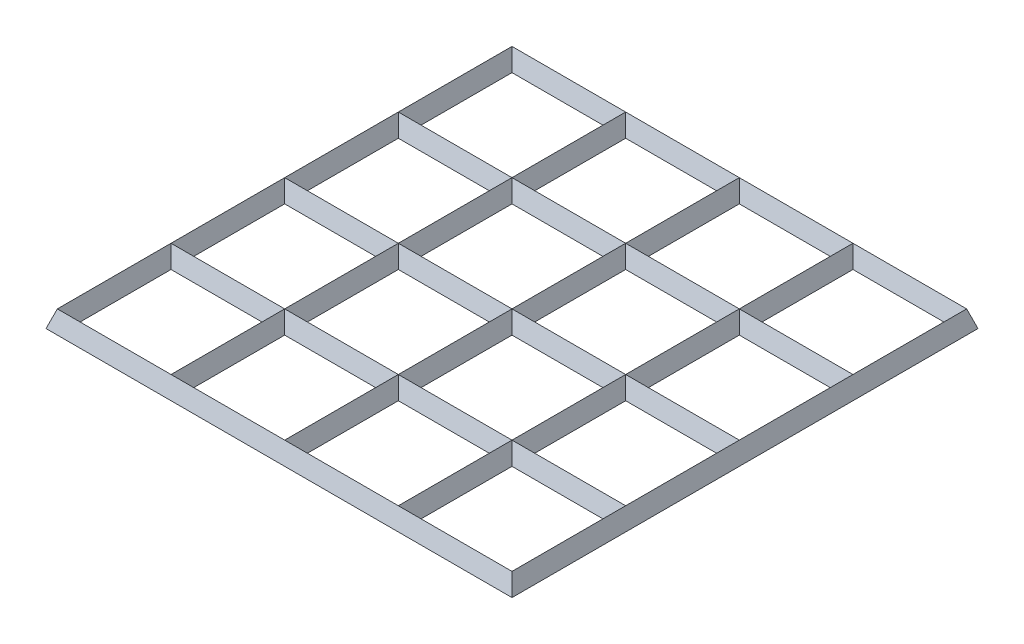
from build123d import *
from OCP.BRepFilletAPI import BRepFilletAPI_MakeChamfer

# Parameters (mm, degrees)
SKETCH_1_W       = 4000
SKETCH_1_H       = 100
SKETCH_1_W_2     = 4100
SKETCH_1_H_2     = 4100
SKETCH_1_W_3     = 3900
SKETCH_1_H_3     = 3900
SKETCH_1_W_4     = 100
SKETCH_1_H_4     = 4000
EXTRUDE_1_DEPTH  = 150
CHAMFER_1_SIZE   = 150
CHAMFER_1_SIZE_2 = 50
CHAMFER_2_SIZE   = 50
CHAMFER_2_SIZE_2 = 150
CHAMFER_3_SIZE   = 150
CHAMFER_3_SIZE_2 = 50
CHAMFER_4_SIZE   = 150
CHAMFER_4_SIZE_2 = 50


with BuildPart() as part:
    # 草图1 → 拉伸-薄壁1 (new body)
    # profile 1 of 7: a face of its own
    with BuildSketch(Plane(origin=(0, 0, 0), x_dir=(1, 0, 0), z_dir=(0, 1, 0))):
        Rectangle(SKETCH_1_W, SKETCH_1_H)
    # profile 2 of 7: a face of its own
    with BuildSketch(Plane(origin=(0, 0, 0), x_dir=(1, 0, 0), z_dir=(0, 1, 0))):
        Rectangle(SKETCH_1_W_2, SKETCH_1_H_2)
        Rectangle(SKETCH_1_W_3, SKETCH_1_H_3, mode=Mode.SUBTRACT)
    # profile 3 of 7: a face of its own
    with BuildSketch(Plane(origin=(0, 0, 0), x_dir=(1, 0, 0), z_dir=(0, 1, 0))):
        Rectangle(SKETCH_1_W_4, SKETCH_1_H_4)
    # profile 4 of 7: a face of its own
    with BuildSketch(Plane(origin=(0, 0, 0), x_dir=(1, 0, 0), z_dir=(0, 1, 0))):
        with Locations((0, 1000)):
            Rectangle(SKETCH_1_W, SKETCH_1_H)
    # profile 5 of 7: a face of its own
    with BuildSketch(Plane(origin=(0, 0, 0), x_dir=(1, 0, 0), z_dir=(0, 1, 0))):
        with Locations((0, -1000)):
            Rectangle(SKETCH_1_W, SKETCH_1_H)
    # profile 6 of 7: a face of its own
    with BuildSketch(Plane(origin=(0, 0, 0), x_dir=(1, 0, 0), z_dir=(0, 1, 0))):
        with Locations((-1000, 0)):
            Rectangle(SKETCH_1_W_4, SKETCH_1_H_4)
    # profile 7 of 7: a face of its own
    with BuildSketch(Plane(origin=(0, 0, 0), x_dir=(1, 0, 0), z_dir=(0, 1, 0))):
        with Locations((1000, 0)):
            Rectangle(SKETCH_1_W_4, SKETCH_1_H_4)
    extrude(amount=EXTRUDE_1_DEPTH)

    # 倒角1
    chamfer_1_edges_1 = [part.edges().sort_by_distance(p)[0] for p in [
        (1950, 150, -1500),
    ]]
    chamfer_1_side_1 = [part.faces().sort_by_distance(p)[0] for p in [
        (1950, 149, -1500),
    ]]
    chamfer_1_edges_2 = [part.edges().sort_by_distance(p)[0] for p in [
        (1950, 150, -500),
    ]]
    chamfer_1_side_2 = [part.faces().sort_by_distance(p)[0] for p in [
        (1950, 149, -500),
    ]]
    chamfer_1_edges_3 = [part.edges().sort_by_distance(p)[0] for p in [
        (1950, 150, 500),
    ]]
    chamfer_1_side_3 = [part.faces().sort_by_distance(p)[0] for p in [
        (1950, 149, 500),
    ]]
    chamfer_1_edges_4 = [part.edges().sort_by_distance(p)[0] for p in [
        (1950, 150, 1500),
    ]]
    chamfer_1_side_4 = [part.faces().sort_by_distance(p)[0] for p in [
        (1950, 149, 1500),
    ]]
    chamfer_1_edges_5 = [part.edges().sort_by_distance(p)[0] for p in [
        (950, 150, 1500),
    ]]
    chamfer_1_side_5 = [part.faces().sort_by_distance(p)[0] for p in [
        (951, 150, 1500),
    ]]
    chamfer_1_edges_6 = [part.edges().sort_by_distance(p)[0] for p in [
        (950, 150, 500),
    ]]
    chamfer_1_side_6 = [part.faces().sort_by_distance(p)[0] for p in [
        (951, 150, 500),
    ]]
    chamfer_1_edges_7 = [part.edges().sort_by_distance(p)[0] for p in [
        (950, 150, -500),
    ]]
    chamfer_1_side_7 = [part.faces().sort_by_distance(p)[0] for p in [
        (951, 150, -500),
    ]]
    chamfer_1_edges_8 = [part.edges().sort_by_distance(p)[0] for p in [
        (950, 150, -1500),
    ]]
    chamfer_1_side_8 = [part.faces().sort_by_distance(p)[0] for p in [
        (951, 150, -1500),
    ]]
    chamfer_1_edges_9 = [part.edges().sort_by_distance(p)[0] for p in [
        (-50, 150, -1500),
    ]]
    chamfer_1_side_9 = [part.faces().sort_by_distance(p)[0] for p in [
        (-50, 149, -1500),
    ]]
    chamfer_1_edges_10 = [part.edges().sort_by_distance(p)[0] for p in [
        (-50, 150, -500),
    ]]
    chamfer_1_side_10 = [part.faces().sort_by_distance(p)[0] for p in [
        (-50, 149, -500),
    ]]
    chamfer_1_edges_11 = [part.edges().sort_by_distance(p)[0] for p in [
        (-50, 150, 500),
    ]]
    chamfer_1_side_11 = [part.faces().sort_by_distance(p)[0] for p in [
        (-50, 149, 500),
    ]]
    chamfer_1_edges_12 = [part.edges().sort_by_distance(p)[0] for p in [
        (-50, 150, 1500),
    ]]
    chamfer_1_side_12 = [part.faces().sort_by_distance(p)[0] for p in [
        (-50, 149, 1500),
    ]]
    chamfer_1_edges_13 = [part.edges().sort_by_distance(p)[0] for p in [
        (-1050, 150, 1500),
    ]]
    chamfer_1_side_13 = [part.faces().sort_by_distance(p)[0] for p in [
        (-1050, 149, 1500),
    ]]
    chamfer_1_edges_14 = [part.edges().sort_by_distance(p)[0] for p in [
        (-1050, 150, 500),
    ]]
    chamfer_1_side_14 = [part.faces().sort_by_distance(p)[0] for p in [
        (-1050, 149, 500),
    ]]
    chamfer_1_edges_15 = [part.edges().sort_by_distance(p)[0] for p in [
        (-1050, 150, -500),
    ]]
    chamfer_1_side_15 = [part.faces().sort_by_distance(p)[0] for p in [
        (-1050, 149, -500),
    ]]
    chamfer_1_edges_16 = [part.edges().sort_by_distance(p)[0] for p in [
        (-1050, 150, -1500),
    ]]
    chamfer_1_side_16 = [part.faces().sort_by_distance(p)[0] for p in [
        (-1050, 149, -1500),
    ]]
    chamfer_1_edges_17 = [part.edges().sort_by_distance(p)[0] for p in [
        (-2050, 150, 0),
    ]]
    chamfer_1_side_17 = [part.faces().sort_by_distance(p)[0] for p in [
        (-2050, 149, 0),
    ]]
    chamfer_1 = BRepFilletAPI_MakeChamfer(part.part.solid().wrapped)
    for e in chamfer_1_edges_1:
        chamfer_1.Add(CHAMFER_1_SIZE - 0.0001, CHAMFER_1_SIZE_2 - 0.0001, e.wrapped, chamfer_1_side_1[0].wrapped)
    for e in chamfer_1_edges_2:
        chamfer_1.Add(CHAMFER_1_SIZE - 0.0001, CHAMFER_1_SIZE_2 - 0.0001, e.wrapped, chamfer_1_side_2[0].wrapped)
    for e in chamfer_1_edges_3:
        chamfer_1.Add(CHAMFER_1_SIZE - 0.0001, CHAMFER_1_SIZE_2 - 0.0001, e.wrapped, chamfer_1_side_3[0].wrapped)
    for e in chamfer_1_edges_4:
        chamfer_1.Add(CHAMFER_1_SIZE - 0.0001, CHAMFER_1_SIZE_2 - 0.0001, e.wrapped, chamfer_1_side_4[0].wrapped)
    for e in chamfer_1_edges_5:
        chamfer_1.Add(CHAMFER_1_SIZE_2 - 0.0001, CHAMFER_1_SIZE - 0.0001, e.wrapped, chamfer_1_side_5[0].wrapped)
    for e in chamfer_1_edges_6:
        chamfer_1.Add(CHAMFER_1_SIZE_2 - 0.0001, CHAMFER_1_SIZE - 0.0001, e.wrapped, chamfer_1_side_6[0].wrapped)
    for e in chamfer_1_edges_7:
        chamfer_1.Add(CHAMFER_1_SIZE_2 - 0.0001, CHAMFER_1_SIZE - 0.0001, e.wrapped, chamfer_1_side_7[0].wrapped)
    for e in chamfer_1_edges_8:
        chamfer_1.Add(CHAMFER_1_SIZE_2 - 0.0001, CHAMFER_1_SIZE - 0.0001, e.wrapped, chamfer_1_side_8[0].wrapped)
    for e in chamfer_1_edges_9:
        chamfer_1.Add(CHAMFER_1_SIZE - 0.0001, CHAMFER_1_SIZE_2 - 0.0001, e.wrapped, chamfer_1_side_9[0].wrapped)
    for e in chamfer_1_edges_10:
        chamfer_1.Add(CHAMFER_1_SIZE - 0.0001, CHAMFER_1_SIZE_2 - 0.0001, e.wrapped, chamfer_1_side_10[0].wrapped)
    for e in chamfer_1_edges_11:
        chamfer_1.Add(CHAMFER_1_SIZE - 0.0001, CHAMFER_1_SIZE_2 - 0.0001, e.wrapped, chamfer_1_side_11[0].wrapped)
    for e in chamfer_1_edges_12:
        chamfer_1.Add(CHAMFER_1_SIZE - 0.0001, CHAMFER_1_SIZE_2 - 0.0001, e.wrapped, chamfer_1_side_12[0].wrapped)
    for e in chamfer_1_edges_13:
        chamfer_1.Add(CHAMFER_1_SIZE - 0.0001, CHAMFER_1_SIZE_2 - 0.0001, e.wrapped, chamfer_1_side_13[0].wrapped)
    for e in chamfer_1_edges_14:
        chamfer_1.Add(CHAMFER_1_SIZE - 0.0001, CHAMFER_1_SIZE_2 - 0.0001, e.wrapped, chamfer_1_side_14[0].wrapped)
    for e in chamfer_1_edges_15:
        chamfer_1.Add(CHAMFER_1_SIZE - 0.0001, CHAMFER_1_SIZE_2 - 0.0001, e.wrapped, chamfer_1_side_15[0].wrapped)
    for e in chamfer_1_edges_16:
        chamfer_1.Add(CHAMFER_1_SIZE - 0.0001, CHAMFER_1_SIZE_2 - 0.0001, e.wrapped, chamfer_1_side_16[0].wrapped)
    for e in chamfer_1_edges_17:
        chamfer_1.Add(CHAMFER_1_SIZE - 0.0001, CHAMFER_1_SIZE_2 - 0.0001, e.wrapped, chamfer_1_side_17[0].wrapped)
    add(Compound.cast(chamfer_1.Shape()), mode=Mode.REPLACE)  # a hair under: the kernel refuses the full size

    # 倒角2
    chamfer_2_edges_1 = [part.edges().sort_by_distance(p)[0] for p in [
        (-1950, 150, -1500),
    ]]
    chamfer_2_side_1 = [part.faces().sort_by_distance(p)[0] for p in [
        (-1951, 150, -1500),
    ]]
    chamfer_2_edges_2 = [part.edges().sort_by_distance(p)[0] for p in [
        (-1950, 150, -500),
    ]]
    chamfer_2_side_2 = [part.faces().sort_by_distance(p)[0] for p in [
        (-1951, 150, -500),
    ]]
    chamfer_2_edges_3 = [part.edges().sort_by_distance(p)[0] for p in [
        (-1950, 150, 500),
    ]]
    chamfer_2_side_3 = [part.faces().sort_by_distance(p)[0] for p in [
        (-1951, 150, 500),
    ]]
    chamfer_2_edges_4 = [part.edges().sort_by_distance(p)[0] for p in [
        (-1950, 150, 1500),
    ]]
    chamfer_2_side_4 = [part.faces().sort_by_distance(p)[0] for p in [
        (-1951, 150, 1500),
    ]]
    chamfer_2_edges_5 = [part.edges().sort_by_distance(p)[0] for p in [
        (-950, 150, 1500),
    ]]
    chamfer_2_side_5 = [part.faces().sort_by_distance(p)[0] for p in [
        (-951, 150, 1500),
    ]]
    chamfer_2_edges_6 = [part.edges().sort_by_distance(p)[0] for p in [
        (-950, 150, 500),
    ]]
    chamfer_2_side_6 = [part.faces().sort_by_distance(p)[0] for p in [
        (-951, 150, 500),
    ]]
    chamfer_2_edges_7 = [part.edges().sort_by_distance(p)[0] for p in [
        (-950, 150, -500),
    ]]
    chamfer_2_side_7 = [part.faces().sort_by_distance(p)[0] for p in [
        (-951, 150, -500),
    ]]
    chamfer_2_edges_8 = [part.edges().sort_by_distance(p)[0] for p in [
        (-950, 150, -1500),
    ]]
    chamfer_2_side_8 = [part.faces().sort_by_distance(p)[0] for p in [
        (-951, 150, -1500),
    ]]
    chamfer_2_edges_9 = [part.edges().sort_by_distance(p)[0] for p in [
        (50, 150, -1500),
    ]]
    chamfer_2_side_9 = [part.faces().sort_by_distance(p)[0] for p in [
        (49, 150, -1500),
    ]]
    chamfer_2_edges_10 = [part.edges().sort_by_distance(p)[0] for p in [
        (50, 150, -500),
    ]]
    chamfer_2_side_10 = [part.faces().sort_by_distance(p)[0] for p in [
        (49, 150, -500),
    ]]
    chamfer_2_edges_11 = [part.edges().sort_by_distance(p)[0] for p in [
        (50, 150, 500),
    ]]
    chamfer_2_side_11 = [part.faces().sort_by_distance(p)[0] for p in [
        (49, 150, 500),
    ]]
    chamfer_2_edges_12 = [part.edges().sort_by_distance(p)[0] for p in [
        (50, 150, 1500),
    ]]
    chamfer_2_side_12 = [part.faces().sort_by_distance(p)[0] for p in [
        (49, 150, 1500),
    ]]
    chamfer_2_edges_13 = [part.edges().sort_by_distance(p)[0] for p in [
        (1050, 150, 1500),
    ]]
    chamfer_2_side_13 = [part.faces().sort_by_distance(p)[0] for p in [
        (1049, 150, 1500),
    ]]
    chamfer_2_edges_14 = [part.edges().sort_by_distance(p)[0] for p in [
        (1050, 150, 500),
    ]]
    chamfer_2_side_14 = [part.faces().sort_by_distance(p)[0] for p in [
        (1049, 150, 500),
    ]]
    chamfer_2_edges_15 = [part.edges().sort_by_distance(p)[0] for p in [
        (1050, 150, -500),
    ]]
    chamfer_2_side_15 = [part.faces().sort_by_distance(p)[0] for p in [
        (1049, 150, -500),
    ]]
    chamfer_2_edges_16 = [part.edges().sort_by_distance(p)[0] for p in [
        (1050, 150, -1500),
    ]]
    chamfer_2_side_16 = [part.faces().sort_by_distance(p)[0] for p in [
        (1049, 150, -1500),
    ]]
    chamfer_2_edges_17 = [part.edges().sort_by_distance(p)[0] for p in [
        (2050, 150, 0),
    ]]
    chamfer_2_side_17 = [part.faces().sort_by_distance(p)[0] for p in [
        (2050, 149, 0),
    ]]
    chamfer_2 = BRepFilletAPI_MakeChamfer(part.part.solid().wrapped)
    for e in chamfer_2_edges_1:
        chamfer_2.Add(CHAMFER_2_SIZE - 0.0001, CHAMFER_2_SIZE_2 - 0.0001, e.wrapped, chamfer_2_side_1[0].wrapped)
    for e in chamfer_2_edges_2:
        chamfer_2.Add(CHAMFER_2_SIZE - 0.0001, CHAMFER_2_SIZE_2 - 0.0001, e.wrapped, chamfer_2_side_2[0].wrapped)
    for e in chamfer_2_edges_3:
        chamfer_2.Add(CHAMFER_2_SIZE - 0.0001, CHAMFER_2_SIZE_2 - 0.0001, e.wrapped, chamfer_2_side_3[0].wrapped)
    for e in chamfer_2_edges_4:
        chamfer_2.Add(CHAMFER_2_SIZE - 0.0001, CHAMFER_2_SIZE_2 - 0.0001, e.wrapped, chamfer_2_side_4[0].wrapped)
    for e in chamfer_2_edges_5:
        chamfer_2.Add(CHAMFER_2_SIZE - 0.0001, CHAMFER_2_SIZE_2 - 0.0001, e.wrapped, chamfer_2_side_5[0].wrapped)
    for e in chamfer_2_edges_6:
        chamfer_2.Add(CHAMFER_2_SIZE - 0.0001, CHAMFER_2_SIZE_2 - 0.0001, e.wrapped, chamfer_2_side_6[0].wrapped)
    for e in chamfer_2_edges_7:
        chamfer_2.Add(CHAMFER_2_SIZE - 0.0001, CHAMFER_2_SIZE_2 - 0.0001, e.wrapped, chamfer_2_side_7[0].wrapped)
    for e in chamfer_2_edges_8:
        chamfer_2.Add(CHAMFER_2_SIZE - 0.0001, CHAMFER_2_SIZE_2 - 0.0001, e.wrapped, chamfer_2_side_8[0].wrapped)
    for e in chamfer_2_edges_9:
        chamfer_2.Add(CHAMFER_2_SIZE - 0.0001, CHAMFER_2_SIZE_2 - 0.0001, e.wrapped, chamfer_2_side_9[0].wrapped)
    for e in chamfer_2_edges_10:
        chamfer_2.Add(CHAMFER_2_SIZE - 0.0001, CHAMFER_2_SIZE_2 - 0.0001, e.wrapped, chamfer_2_side_10[0].wrapped)
    for e in chamfer_2_edges_11:
        chamfer_2.Add(CHAMFER_2_SIZE - 0.0001, CHAMFER_2_SIZE_2 - 0.0001, e.wrapped, chamfer_2_side_11[0].wrapped)
    for e in chamfer_2_edges_12:
        chamfer_2.Add(CHAMFER_2_SIZE - 0.0001, CHAMFER_2_SIZE_2 - 0.0001, e.wrapped, chamfer_2_side_12[0].wrapped)
    for e in chamfer_2_edges_13:
        chamfer_2.Add(CHAMFER_2_SIZE - 0.0001, CHAMFER_2_SIZE_2 - 0.0001, e.wrapped, chamfer_2_side_13[0].wrapped)
    for e in chamfer_2_edges_14:
        chamfer_2.Add(CHAMFER_2_SIZE - 0.0001, CHAMFER_2_SIZE_2 - 0.0001, e.wrapped, chamfer_2_side_14[0].wrapped)
    for e in chamfer_2_edges_15:
        chamfer_2.Add(CHAMFER_2_SIZE - 0.0001, CHAMFER_2_SIZE_2 - 0.0001, e.wrapped, chamfer_2_side_15[0].wrapped)
    for e in chamfer_2_edges_16:
        chamfer_2.Add(CHAMFER_2_SIZE - 0.0001, CHAMFER_2_SIZE_2 - 0.0001, e.wrapped, chamfer_2_side_16[0].wrapped)
    for e in chamfer_2_edges_17:
        chamfer_2.Add(CHAMFER_2_SIZE_2 - 0.0001, CHAMFER_2_SIZE - 0.0001, e.wrapped, chamfer_2_side_17[0].wrapped)
    add(Compound.cast(chamfer_2.Shape()), mode=Mode.REPLACE)  # a hair under: the kernel refuses the full size

    # 倒角3
    chamfer_3_edges_1 = [part.edges().sort_by_distance(p)[0] for p in [
        (-1500, 150, 1950),
    ]]
    chamfer_3_side_1 = [part.faces().sort_by_distance(p)[0] for p in [
        (-1500, 149, 1950),
    ]]
    chamfer_3_edges_2 = [part.edges().sort_by_distance(p)[0] for p in [
        (-500, 150, 1950),
    ]]
    chamfer_3_side_2 = [part.faces().sort_by_distance(p)[0] for p in [
        (-500, 149, 1950),
    ]]
    chamfer_3_edges_3 = [part.edges().sort_by_distance(p)[0] for p in [
        (500, 150, 1950),
    ]]
    chamfer_3_side_3 = [part.faces().sort_by_distance(p)[0] for p in [
        (500, 149, 1950),
    ]]
    chamfer_3_edges_4 = [part.edges().sort_by_distance(p)[0] for p in [
        (1500, 150, 1950),
    ]]
    chamfer_3_side_4 = [part.faces().sort_by_distance(p)[0] for p in [
        (1500, 149, 1950),
    ]]
    chamfer_3_edges_5 = [part.edges().sort_by_distance(p)[0] for p in [
        (1500, 150, 950),
    ]]
    chamfer_3_side_5 = [part.faces().sort_by_distance(p)[0] for p in [
        (1500, 149, 950),
    ]]
    chamfer_3_edges_6 = [part.edges().sort_by_distance(p)[0] for p in [
        (500, 150, 950),
    ]]
    chamfer_3_side_6 = [part.faces().sort_by_distance(p)[0] for p in [
        (500, 149, 950),
    ]]
    chamfer_3_edges_7 = [part.edges().sort_by_distance(p)[0] for p in [
        (-500, 150, 950),
    ]]
    chamfer_3_side_7 = [part.faces().sort_by_distance(p)[0] for p in [
        (-500, 149, 950),
    ]]
    chamfer_3_edges_8 = [part.edges().sort_by_distance(p)[0] for p in [
        (-1500, 150, 950),
    ]]
    chamfer_3_side_8 = [part.faces().sort_by_distance(p)[0] for p in [
        (-1500, 149, 950),
    ]]
    chamfer_3_edges_9 = [part.edges().sort_by_distance(p)[0] for p in [
        (1500, 150, -50),
    ]]
    chamfer_3_side_9 = [part.faces().sort_by_distance(p)[0] for p in [
        (1500, 149, -50),
    ]]
    chamfer_3_edges_10 = [part.edges().sort_by_distance(p)[0] for p in [
        (500, 150, -50),
    ]]
    chamfer_3_side_10 = [part.faces().sort_by_distance(p)[0] for p in [
        (500, 149, -50),
    ]]
    chamfer_3_edges_11 = [part.edges().sort_by_distance(p)[0] for p in [
        (-500, 150, -50),
    ]]
    chamfer_3_side_11 = [part.faces().sort_by_distance(p)[0] for p in [
        (-500, 149, -50),
    ]]
    chamfer_3_edges_12 = [part.edges().sort_by_distance(p)[0] for p in [
        (-1500, 150, -50),
    ]]
    chamfer_3_side_12 = [part.faces().sort_by_distance(p)[0] for p in [
        (-1500, 149, -50),
    ]]
    chamfer_3_edges_13 = [part.edges().sort_by_distance(p)[0] for p in [
        (1500, 150, -1050),
    ]]
    chamfer_3_side_13 = [part.faces().sort_by_distance(p)[0] for p in [
        (1500, 149, -1050),
    ]]
    chamfer_3_edges_14 = [part.edges().sort_by_distance(p)[0] for p in [
        (500, 150, -1050),
    ]]
    chamfer_3_side_14 = [part.faces().sort_by_distance(p)[0] for p in [
        (500, 149, -1050),
    ]]
    chamfer_3_edges_15 = [part.edges().sort_by_distance(p)[0] for p in [
        (-500, 150, -1050),
    ]]
    chamfer_3_side_15 = [part.faces().sort_by_distance(p)[0] for p in [
        (-500, 149, -1050),
    ]]
    chamfer_3_edges_16 = [part.edges().sort_by_distance(p)[0] for p in [
        (-1500, 150, -1050),
    ]]
    chamfer_3_side_16 = [part.faces().sort_by_distance(p)[0] for p in [
        (-1500, 149, -1050),
    ]]
    chamfer_3_edges_17 = [part.edges().sort_by_distance(p)[0] for p in [
        (0, 150, -2050),
    ]]
    chamfer_3_side_17 = [part.faces().sort_by_distance(p)[0] for p in [
        (0, 149, -2050),
    ]]
    chamfer_3 = BRepFilletAPI_MakeChamfer(part.part.solid().wrapped)
    for e in chamfer_3_edges_1:
        chamfer_3.Add(CHAMFER_3_SIZE - 0.0001, CHAMFER_3_SIZE_2 - 0.0001, e.wrapped, chamfer_3_side_1[0].wrapped)
    for e in chamfer_3_edges_2:
        chamfer_3.Add(CHAMFER_3_SIZE - 0.0001, CHAMFER_3_SIZE_2 - 0.0001, e.wrapped, chamfer_3_side_2[0].wrapped)
    for e in chamfer_3_edges_3:
        chamfer_3.Add(CHAMFER_3_SIZE - 0.0001, CHAMFER_3_SIZE_2 - 0.0001, e.wrapped, chamfer_3_side_3[0].wrapped)
    for e in chamfer_3_edges_4:
        chamfer_3.Add(CHAMFER_3_SIZE - 0.0001, CHAMFER_3_SIZE_2 - 0.0001, e.wrapped, chamfer_3_side_4[0].wrapped)
    for e in chamfer_3_edges_5:
        chamfer_3.Add(CHAMFER_3_SIZE - 0.0001, CHAMFER_3_SIZE_2 - 0.0001, e.wrapped, chamfer_3_side_5[0].wrapped)
    for e in chamfer_3_edges_6:
        chamfer_3.Add(CHAMFER_3_SIZE - 0.0001, CHAMFER_3_SIZE_2 - 0.0001, e.wrapped, chamfer_3_side_6[0].wrapped)
    for e in chamfer_3_edges_7:
        chamfer_3.Add(CHAMFER_3_SIZE - 0.0001, CHAMFER_3_SIZE_2 - 0.0001, e.wrapped, chamfer_3_side_7[0].wrapped)
    for e in chamfer_3_edges_8:
        chamfer_3.Add(CHAMFER_3_SIZE - 0.0001, CHAMFER_3_SIZE_2 - 0.0001, e.wrapped, chamfer_3_side_8[0].wrapped)
    for e in chamfer_3_edges_9:
        chamfer_3.Add(CHAMFER_3_SIZE - 0.0001, CHAMFER_3_SIZE_2 - 0.0001, e.wrapped, chamfer_3_side_9[0].wrapped)
    for e in chamfer_3_edges_10:
        chamfer_3.Add(CHAMFER_3_SIZE - 0.0001, CHAMFER_3_SIZE_2 - 0.0001, e.wrapped, chamfer_3_side_10[0].wrapped)
    for e in chamfer_3_edges_11:
        chamfer_3.Add(CHAMFER_3_SIZE - 0.0001, CHAMFER_3_SIZE_2 - 0.0001, e.wrapped, chamfer_3_side_11[0].wrapped)
    for e in chamfer_3_edges_12:
        chamfer_3.Add(CHAMFER_3_SIZE - 0.0001, CHAMFER_3_SIZE_2 - 0.0001, e.wrapped, chamfer_3_side_12[0].wrapped)
    for e in chamfer_3_edges_13:
        chamfer_3.Add(CHAMFER_3_SIZE - 0.0001, CHAMFER_3_SIZE_2 - 0.0001, e.wrapped, chamfer_3_side_13[0].wrapped)
    for e in chamfer_3_edges_14:
        chamfer_3.Add(CHAMFER_3_SIZE - 0.0001, CHAMFER_3_SIZE_2 - 0.0001, e.wrapped, chamfer_3_side_14[0].wrapped)
    for e in chamfer_3_edges_15:
        chamfer_3.Add(CHAMFER_3_SIZE - 0.0001, CHAMFER_3_SIZE_2 - 0.0001, e.wrapped, chamfer_3_side_15[0].wrapped)
    for e in chamfer_3_edges_16:
        chamfer_3.Add(CHAMFER_3_SIZE - 0.0001, CHAMFER_3_SIZE_2 - 0.0001, e.wrapped, chamfer_3_side_16[0].wrapped)
    for e in chamfer_3_edges_17:
        chamfer_3.Add(CHAMFER_3_SIZE - 0.0001, CHAMFER_3_SIZE_2 - 0.0001, e.wrapped, chamfer_3_side_17[0].wrapped)
    add(Compound.cast(chamfer_3.Shape()), mode=Mode.REPLACE)  # a hair under: the kernel refuses the full size

    # 倒角4
    chamfer_4_edges_1 = [part.edges().sort_by_distance(p)[0] for p in [
        (-1500, 150, 1050),
    ]]
    chamfer_4_side_1 = [part.faces().sort_by_distance(p)[0] for p in [
        (-1500, 149, 1050),
    ]]
    chamfer_4_edges_2 = [part.edges().sort_by_distance(p)[0] for p in [
        (-500, 150, 1050),
    ]]
    chamfer_4_side_2 = [part.faces().sort_by_distance(p)[0] for p in [
        (-500, 149, 1050),
    ]]
    chamfer_4_edges_3 = [part.edges().sort_by_distance(p)[0] for p in [
        (500, 150, 1050),
    ]]
    chamfer_4_side_3 = [part.faces().sort_by_distance(p)[0] for p in [
        (500, 149, 1050),
    ]]
    chamfer_4_edges_4 = [part.edges().sort_by_distance(p)[0] for p in [
        (1500, 150, 1050),
    ]]
    chamfer_4_side_4 = [part.faces().sort_by_distance(p)[0] for p in [
        (1500, 149, 1050),
    ]]
    chamfer_4_edges_5 = [part.edges().sort_by_distance(p)[0] for p in [
        (-1500, 150, 50),
    ]]
    chamfer_4_side_5 = [part.faces().sort_by_distance(p)[0] for p in [
        (-1500, 149, 50),
    ]]
    chamfer_4_edges_6 = [part.edges().sort_by_distance(p)[0] for p in [
        (-500, 150, 50),
    ]]
    chamfer_4_side_6 = [part.faces().sort_by_distance(p)[0] for p in [
        (-500, 149, 50),
    ]]
    chamfer_4_edges_7 = [part.edges().sort_by_distance(p)[0] for p in [
        (500, 150, 50),
    ]]
    chamfer_4_side_7 = [part.faces().sort_by_distance(p)[0] for p in [
        (500, 149, 50),
    ]]
    chamfer_4_edges_8 = [part.edges().sort_by_distance(p)[0] for p in [
        (1500, 150, 50),
    ]]
    chamfer_4_side_8 = [part.faces().sort_by_distance(p)[0] for p in [
        (1500, 149, 50),
    ]]
    chamfer_4_edges_9 = [part.edges().sort_by_distance(p)[0] for p in [
        (-1500, 150, -950),
    ]]
    chamfer_4_side_9 = [part.faces().sort_by_distance(p)[0] for p in [
        (-1500, 149, -950),
    ]]
    chamfer_4_edges_10 = [part.edges().sort_by_distance(p)[0] for p in [
        (-500, 150, -950),
    ]]
    chamfer_4_side_10 = [part.faces().sort_by_distance(p)[0] for p in [
        (-500, 149, -950),
    ]]
    chamfer_4_edges_11 = [part.edges().sort_by_distance(p)[0] for p in [
        (500, 150, -950),
    ]]
    chamfer_4_side_11 = [part.faces().sort_by_distance(p)[0] for p in [
        (500, 149, -950),
    ]]
    chamfer_4_edges_12 = [part.edges().sort_by_distance(p)[0] for p in [
        (1500, 150, -950),
    ]]
    chamfer_4_side_12 = [part.faces().sort_by_distance(p)[0] for p in [
        (1500, 149, -950),
    ]]
    chamfer_4_edges_13 = [part.edges().sort_by_distance(p)[0] for p in [
        (-1500, 150, -1950),
    ]]
    chamfer_4_side_13 = [part.faces().sort_by_distance(p)[0] for p in [
        (-1500, 149, -1950),
    ]]
    chamfer_4_edges_14 = [part.edges().sort_by_distance(p)[0] for p in [
        (-500, 150, -1950),
    ]]
    chamfer_4_side_14 = [part.faces().sort_by_distance(p)[0] for p in [
        (-500, 149, -1950),
    ]]
    chamfer_4_edges_15 = [part.edges().sort_by_distance(p)[0] for p in [
        (500, 150, -1950),
    ]]
    chamfer_4_side_15 = [part.faces().sort_by_distance(p)[0] for p in [
        (500, 149, -1950),
    ]]
    chamfer_4_edges_16 = [part.edges().sort_by_distance(p)[0] for p in [
        (1500, 150, -1950),
    ]]
    chamfer_4_side_16 = [part.faces().sort_by_distance(p)[0] for p in [
        (1500, 149, -1950),
    ]]
    chamfer_4_edges_17 = [part.edges().sort_by_distance(p)[0] for p in [
        (0, 150, 2050),
    ]]
    chamfer_4_side_17 = [part.faces().sort_by_distance(p)[0] for p in [
        (0, 149, 2050),
    ]]
    chamfer_4 = BRepFilletAPI_MakeChamfer(part.part.solid().wrapped)
    for e in chamfer_4_edges_1:
        chamfer_4.Add(CHAMFER_4_SIZE - 0.0001, CHAMFER_4_SIZE_2 - 0.0001, e.wrapped, chamfer_4_side_1[0].wrapped)
    for e in chamfer_4_edges_2:
        chamfer_4.Add(CHAMFER_4_SIZE - 0.0001, CHAMFER_4_SIZE_2 - 0.0001, e.wrapped, chamfer_4_side_2[0].wrapped)
    for e in chamfer_4_edges_3:
        chamfer_4.Add(CHAMFER_4_SIZE - 0.0001, CHAMFER_4_SIZE_2 - 0.0001, e.wrapped, chamfer_4_side_3[0].wrapped)
    for e in chamfer_4_edges_4:
        chamfer_4.Add(CHAMFER_4_SIZE - 0.0001, CHAMFER_4_SIZE_2 - 0.0001, e.wrapped, chamfer_4_side_4[0].wrapped)
    for e in chamfer_4_edges_5:
        chamfer_4.Add(CHAMFER_4_SIZE - 0.0001, CHAMFER_4_SIZE_2 - 0.0001, e.wrapped, chamfer_4_side_5[0].wrapped)
    for e in chamfer_4_edges_6:
        chamfer_4.Add(CHAMFER_4_SIZE - 0.0001, CHAMFER_4_SIZE_2 - 0.0001, e.wrapped, chamfer_4_side_6[0].wrapped)
    for e in chamfer_4_edges_7:
        chamfer_4.Add(CHAMFER_4_SIZE - 0.0001, CHAMFER_4_SIZE_2 - 0.0001, e.wrapped, chamfer_4_side_7[0].wrapped)
    for e in chamfer_4_edges_8:
        chamfer_4.Add(CHAMFER_4_SIZE - 0.0001, CHAMFER_4_SIZE_2 - 0.0001, e.wrapped, chamfer_4_side_8[0].wrapped)
    for e in chamfer_4_edges_9:
        chamfer_4.Add(CHAMFER_4_SIZE - 0.0001, CHAMFER_4_SIZE_2 - 0.0001, e.wrapped, chamfer_4_side_9[0].wrapped)
    for e in chamfer_4_edges_10:
        chamfer_4.Add(CHAMFER_4_SIZE - 0.0001, CHAMFER_4_SIZE_2 - 0.0001, e.wrapped, chamfer_4_side_10[0].wrapped)
    for e in chamfer_4_edges_11:
        chamfer_4.Add(CHAMFER_4_SIZE - 0.0001, CHAMFER_4_SIZE_2 - 0.0001, e.wrapped, chamfer_4_side_11[0].wrapped)
    for e in chamfer_4_edges_12:
        chamfer_4.Add(CHAMFER_4_SIZE - 0.0001, CHAMFER_4_SIZE_2 - 0.0001, e.wrapped, chamfer_4_side_12[0].wrapped)
    for e in chamfer_4_edges_13:
        chamfer_4.Add(CHAMFER_4_SIZE - 0.0001, CHAMFER_4_SIZE_2 - 0.0001, e.wrapped, chamfer_4_side_13[0].wrapped)
    for e in chamfer_4_edges_14:
        chamfer_4.Add(CHAMFER_4_SIZE - 0.0001, CHAMFER_4_SIZE_2 - 0.0001, e.wrapped, chamfer_4_side_14[0].wrapped)
    for e in chamfer_4_edges_15:
        chamfer_4.Add(CHAMFER_4_SIZE - 0.0001, CHAMFER_4_SIZE_2 - 0.0001, e.wrapped, chamfer_4_side_15[0].wrapped)
    for e in chamfer_4_edges_16:
        chamfer_4.Add(CHAMFER_4_SIZE - 0.0001, CHAMFER_4_SIZE_2 - 0.0001, e.wrapped, chamfer_4_side_16[0].wrapped)
    for e in chamfer_4_edges_17:
        chamfer_4.Add(CHAMFER_4_SIZE - 0.0001, CHAMFER_4_SIZE_2 - 0.0001, e.wrapped, chamfer_4_side_17[0].wrapped)
    add(Compound.cast(chamfer_4.Shape()), mode=Mode.REPLACE)  # a hair under: the kernel refuses the full size


solid = part.part
